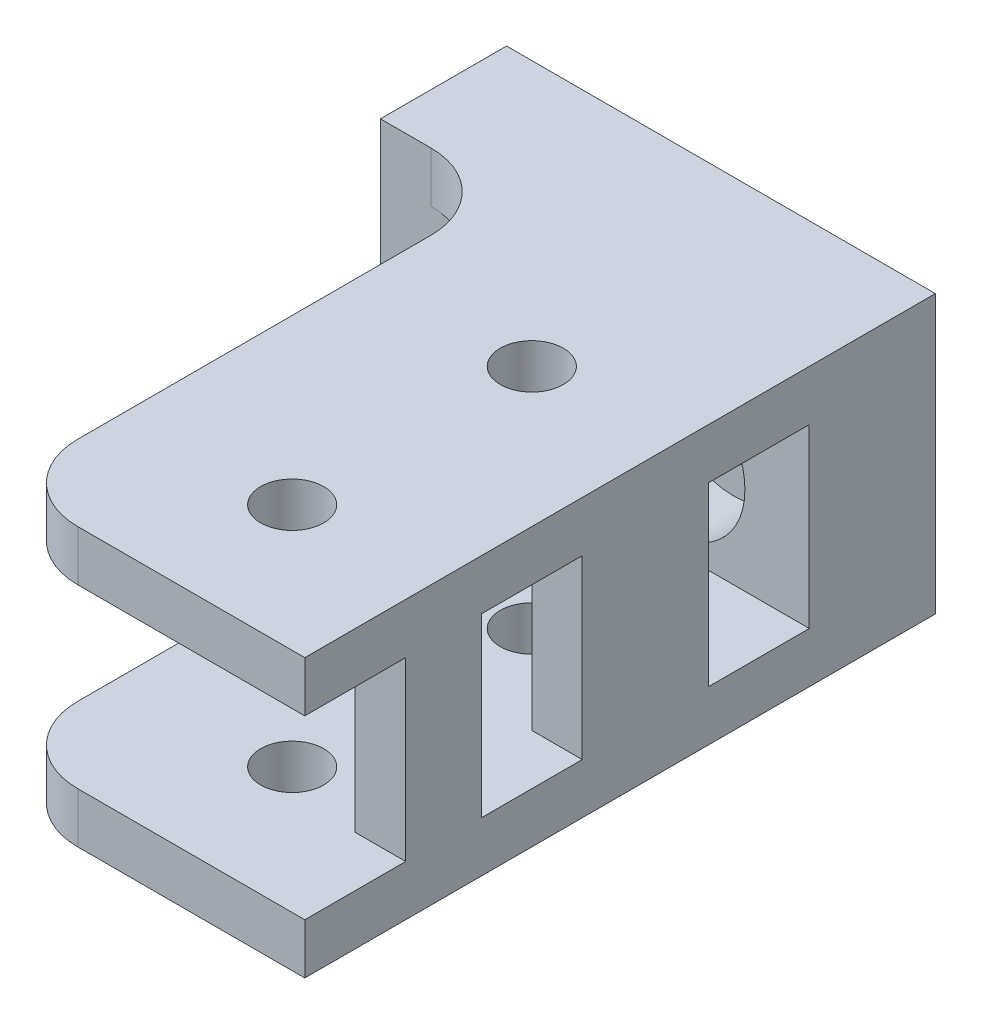
from build123d import *

# Parameters (mm, degrees)
ESQUISSE1_W             = 17
ESQUISSE1_H             = 11
ESQUISSE1_R             = 1.75
BOSS_EXTRU_1_DEPTH      = 5
ESQUISSE2_W             = 2
ESQUISSE2_H             = 7
BOSS_EXTRU_2_DEPTH      = 20
ESQUISSE3_W             = 4
ESQUISSE3_H             = 7
ENL_V_MAT_EXTRU_1_DEPTH = 20
ESQUISSE4_R             = 1.25
ESQUISSE4_W             = 5
ESQUISSE4_H             = 20
ENL_V_MAT_EXTRU_2_DEPTH = 20
ESQUISSE5_R             = 2.95
ENL_V_MAT_EXTRU_3_DEPTH = 2.5
CONG_1_START            = -11
CONG_1_DEPTH            = 11
CONG_1_2_DEPTH          = 2
CONG_1_START_2          = -2
CONG_1_3_DEPTH          = 2


with BuildPart() as part:
    # Esquisse1 → Boss.-Extru.1 (new body)
    with BuildSketch(Plane.XY):
        with Locations((8.5, -5.5)):
            Rectangle(ESQUISSE1_W, ESQUISSE1_H)
        with Locations((5.5, -5.5)):
            Circle(ESQUISSE1_R, mode=Mode.SUBTRACT)
        with Locations((11.5, -5.5)):
            Circle(ESQUISSE1_R, mode=Mode.SUBTRACT)
    extrude(amount=BOSS_EXTRU_1_DEPTH)

    # Esquisse2 → Boss.-Extru.2 (add)
    with BuildSketch(Plane.XY.offset(5)):
        Polygon((15, -9), (0, -9), (0, -11), (17, -11), (17, -9), align=None)
        with Locations((16, -5.5)):
            Rectangle(ESQUISSE2_W, ESQUISSE2_H)
        Polygon((17, 0), (0, 0), (0, -2), (15, -2), (17, -2), align=None)
    extrude(amount=BOSS_EXTRU_2_DEPTH)

    # Esquisse3 → Enlèv. mat.-Extru.1 (cut)
    with BuildSketch(Plane.ZY.offset(-15)):
        with Locations((7, -5.5)):
            Rectangle(ESQUISSE3_W, ESQUISSE3_H)
        with Locations((23, -5.5)):
            Rectangle(ESQUISSE3_W, ESQUISSE3_H)
        with Locations((16, -5.5)):
            Rectangle(ESQUISSE3_W, ESQUISSE3_H)
    extrude(amount=-ENL_V_MAT_EXTRU_1_DEPTH, mode=Mode.SUBTRACT)

    # Esquisse4 → Enlèv. mat.-Extru.2 (cut)
    with BuildSketch(Plane(origin=(0, -11, 0), x_dir=(-1, 0, 0), z_dir=(0, -1, 0))):
        with Locations(Location((-11.5, -20, 0), (0, 0, 90))):
            Circle(ESQUISSE4_R)
        with Locations(Location((-11.5, -10.5, 0), (0, 0, 90))):
            Circle(ESQUISSE4_R)
        with Locations((-2.5, -15)):
            Rectangle(ESQUISSE4_W, ESQUISSE4_H)
    extrude(amount=-ENL_V_MAT_EXTRU_2_DEPTH, mode=Mode.SUBTRACT)

    # Esquisse5 → Enlèv. mat.-Extru.3 (cut)
    with BuildSketch(Plane.XY.offset(5)):
        with Locations((5.5, -5.5)):
            Circle(ESQUISSE5_R)
        with Locations((11.5, -5.5)):
            Circle(ESQUISSE5_R)
    extrude(amount=-ENL_V_MAT_EXTRU_3_DEPTH, mode=Mode.SUBTRACT)

    # Congé1: read off the stored shape, not the designer's step
    # Congé1 outline → Congé1 (cut)
    with BuildSketch(Plane(origin=(0, 0, 0), x_dir=(1, 0, 0), z_dir=(0, 1, 0)).offset(CONG_1_START)):
        with BuildLine():
            ThreePointArc((8, -25), (5.878679656, -24.121320344), (5, -22))
            Line((5, -22), (5, -25))
            Line((5, -25), (8, -25))
        make_face()
    extrude(amount=CONG_1_DEPTH, mode=Mode.SUBTRACT)

    # Cong_1 2 outline → Cong_1 2 (add)
    with BuildSketch(Plane(origin=(0, 0, 0), x_dir=(1, 0, 0), z_dir=(0, 1, 0)).offset(CONG_1_START)):
        with BuildLine():
            ThreePointArc((2, -5), (4.121320344, -5.878679656), (5, -8))
            Line((5, -8), (5, -5))
            Line((5, -5), (2, -5))
        make_face()
    extrude(amount=CONG_1_2_DEPTH)

    # Cong_1 3 outline → Cong_1 3 (add)
    with BuildSketch(Plane(origin=(0, 0, 0), x_dir=(1, 0, 0), z_dir=(0, 1, 0)).offset(CONG_1_START_2)):
        with BuildLine():
            ThreePointArc((2, -5), (4.121320344, -5.878679656), (5, -8))
            Line((5, -8), (5, -5))
            Line((5, -5), (2, -5))
        make_face()
    extrude(amount=CONG_1_3_DEPTH)


solid = part.part
